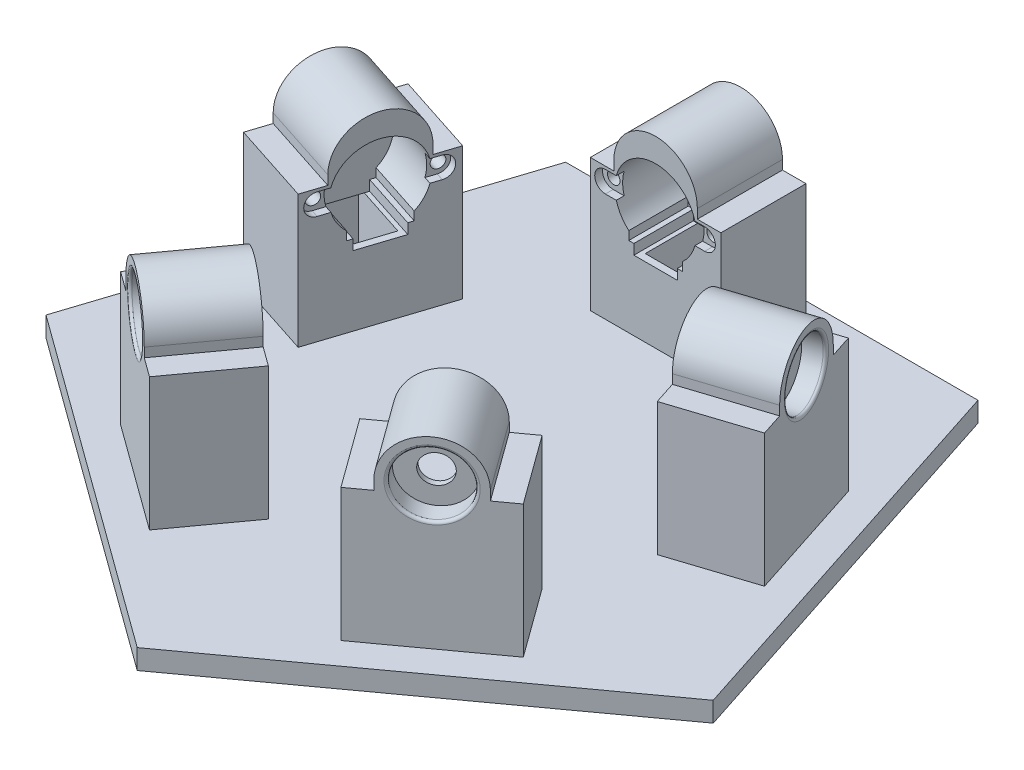
from build123d import *

# Parameters (mm, degrees)
BASE_DEPTH          = 7
BOSS_EXTRUDE1_DEPTH = 20.95
BOSS_EXTRUDE2_DEPTH = 9.05
SKETCH6_R           = 2.2
CUT_EXTRUDE2_DEPTH  = 10
CUT_EXTRUDE3_DEPTH  = 2.75
SKETCH8_W           = 8.290514233
SKETCH8_H           = 3.25
CUT_EXTRUDE4_DEPTH  = 227.650575612
SKETCH11_R          = 11.15
BEARING_HOLE_DEPTH  = 7
SKETCH9_W           = 12.3
SKETCH9_H           = 21.5
WIRE_HOLE_DEPTH     = 50
SKETCH14_R          = 5
CUT_EXTRUDE5_DEPTH  = 246.564036702
FILLET1_R           = 1
CIRPATTERN2_COUNT   = 5
SKETCH13_R          = 5
CAMERA_HOLE_DEPTH   = 183.443465519


with BuildPart() as part:
    # Sketch12 → Base (new body)
    with BuildSketch(Plane(origin=(0, 0, 0), x_dir=(1, 0, 0), z_dir=(0, 1, 0))):
        Polygon((0, -123.60679775), (117.557050458, -38.196601125), (72.654252801, 100), (-72.654252801, 100), (-117.557050458, -38.196601125), align=None)
    extrude(amount=-BASE_DEPTH)


with BuildPart() as body_2:
    # Sketch2 → Boss-Extrude1 (new body)
    with BuildSketch(Plane.XY.offset(-80)):
        with BuildLine():
            Line((-14.709485767, 50), (-23, 50))
            Line((-23, 50), (-23, 0))
            Line((-23, 0), (23, 0))
            Line((23, 0), (23, 50))
            Line((23, 50), (14.709485767, 50))
            ThreePointArc((14.709485767, 50), (0, 64.709485767), (-14.709485767, 50))
        make_face()
        with BuildLine():
            Line((-7.65, 28.18), (-7.65, 24.59))
            Line((-7.65, 24.59), (7.65, 24.59))
            Line((7.65, 24.59), (7.65, 28.18))
            Line((7.65, 28.18), (9.45, 28.18))
            Line((9.45, 28.18), (9.45, 31.2))
            ThreePointArc((9.45, 31.2), (0, 56.349074034), (-9.45, 31.2))
            Line((-9.45, 31.2), (-9.45, 28.18))
            Line((-9.45, 28.18), (-7.65, 28.18))
        make_face(mode=Mode.SUBTRACT)
    extrude(amount=BOSS_EXTRUDE1_DEPTH)

    # Sketch3 → Boss-Extrude2 (add)
    with BuildSketch(Plane.XY.offset(-80)):
        with BuildLine():
            Line((-14.709485767, 50), (-23, 50))
            Line((-23, 50), (-23, 0))
            Line((-23, 0), (23, 0))
            Line((23, 0), (23, 50))
            Line((23, 50), (14.709485767, 50))
            ThreePointArc((14.709485767, 50), (0, 64.709485767), (-14.709485767, 50))
        make_face()
    extrude(amount=-BOSS_EXTRUDE2_DEPTH)

    # Sketch6 → Cut-Extrude2 (cut)
    with BuildSketch(Plane.XY.offset(-59.05)):
        with Locations((-17.5, 42)):
            Circle(SKETCH6_R)
        with Locations((17.5, 42)):
            Circle(SKETCH6_R)
    extrude(amount=-CUT_EXTRUDE2_DEPTH, mode=Mode.SUBTRACT)

    # Sketch7 → Cut-Extrude3 (cut)
    with BuildSketch(Plane.XY.offset(-59.05)):
        with BuildLine():
            Line((-17.7, 45.75), (17.3, 45.75))
            ThreePointArc((17.3, 45.75), (21.05, 42), (17.3, 38.25))
            Line((17.3, 38.25), (-17.7, 38.25))
            ThreePointArc((-17.7, 38.25), (-21.45, 42), (-17.7, 45.75))
        make_face()
    extrude(amount=-CUT_EXTRUDE3_DEPTH, mode=Mode.SUBTRACT)

    # Sketch8 → Cut-Extrude4 (cut, symmetric)
    with BuildSketch(Plane.XY.offset(-59.05)):
        with Locations((-18.854742884, 48.375)):
            Rectangle(SKETCH8_W, SKETCH8_H)
        with Locations((18.854742884, 48.375)):
            Rectangle(SKETCH8_W, SKETCH8_H)
    extrude(amount=CUT_EXTRUDE4_DEPTH, both=True, mode=Mode.SUBTRACT)

    # Sketch11 → Bearing Hole (cut)
    with BuildSketch(Plane(origin=(0, 0, -89.05), x_dir=(-1, 0, 0), z_dir=(0, 0, -1))):
        with Locations((0, 50)):
            Circle(SKETCH11_R)
    extrude(amount=-BEARING_HOLE_DEPTH, mode=Mode.SUBTRACT)


with BuildPart() as wire_hole_tool:
    # Sketch9 → Wire Hole (new body)
    with BuildSketch(Plane(origin=(0, 24.59, -19.25), x_dir=(-1, 0, 0), z_dir=(0, 1, 0))):
        with Locations((0, -53.05)):
            Rectangle(SKETCH9_W, SKETCH9_H)
    extrude(amount=-WIRE_HOLE_DEPTH)


with BuildPart() as part_1:
    add(part.part)

    # Wire Hole: cut by wire_hole_tool
    add(wire_hole_tool.part, mode=Mode.SUBTRACT)

    # Sketch13 → Camera Hole (cut, through all)
    with BuildSketch(Plane(origin=(0, 0, 0), x_dir=(1, 0, 0), z_dir=(0, 1, 0))):
        Circle(SKETCH13_R)
    extrude(amount=-CAMERA_HOLE_DEPTH, mode=Mode.SUBTRACT)


with BuildPart() as body_2_1:
    add(body_2.part)

    # Wire Hole: cut by wire_hole_tool
    add(wire_hole_tool.part, mode=Mode.SUBTRACT)

    # Sketch14 → Cut-Extrude5 (cut, through all)
    with BuildSketch(Plane(origin=(0, 0, -82.05), x_dir=(-1, 0, 0), z_dir=(0, 0, -1))):
        with Locations((0, 50)):
            Circle(SKETCH14_R)
    extrude(amount=-CUT_EXTRUDE5_DEPTH, mode=Mode.SUBTRACT)

    # Fillet1
    fillet1_edges = [body_2_1.edges().sort_by_distance(p)[0] for p in [
        (11.15, 50, -89.05),
    ]]
    fillet(fillet1_edges, radius=FILLET1_R)


with BuildPart() as cirpattern2_1:
    # CirPattern2: pattern copy
    add(body_2_1.part.rotate(Axis((0, -9.447974288, 0), (0, 1, 0)), 1 * 360 / CIRPATTERN2_COUNT))


with BuildPart() as cirpattern2_2:
    # CirPattern2: pattern copy
    add(body_2_1.part.rotate(Axis((0, -9.447974288, 0), (0, 1, 0)), 2 * 360 / CIRPATTERN2_COUNT))


with BuildPart() as cirpattern2_3:
    # CirPattern2: pattern copy
    add(body_2_1.part.rotate(Axis((0, -9.447974288, 0), (0, 1, 0)), 3 * 360 / CIRPATTERN2_COUNT))


with BuildPart() as cirpattern2_4:
    # CirPattern2: pattern copy
    add(body_2_1.part.rotate(Axis((0, -9.447974288, 0), (0, 1, 0)), 4 * 360 / CIRPATTERN2_COUNT))


solid = Compound([part_1.part, body_2_1.part, cirpattern2_1.part, cirpattern2_2.part, cirpattern2_3.part, cirpattern2_4.part])
